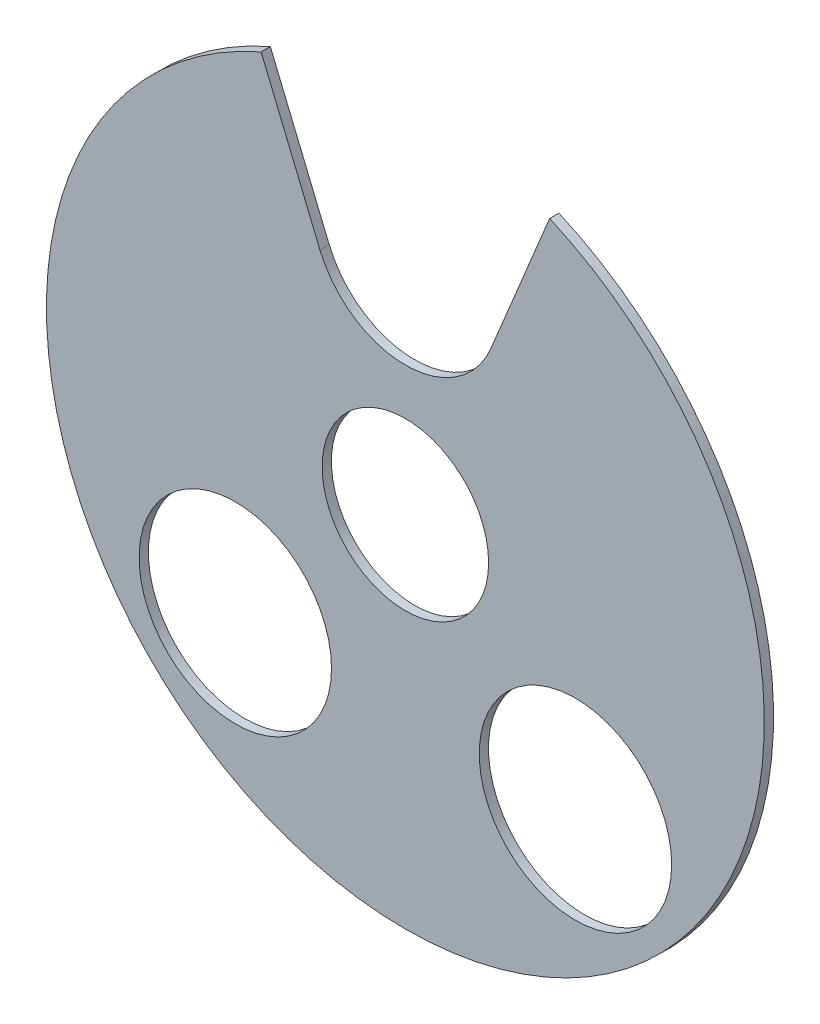
from build123d import *

# Parameters (mm, degrees)
ESQUISSE1_R      = 97
ESQUISSE1_R_2    = 22.5
MAIN_DEPTH       = 2.5
HOLES_DEPTH      = 138.201494161
HOLES_DEPTH_BACK = 138.201494161
ESQUISSE2_R      = 26


with BuildPart() as part:
    # Esquisse1 → Main (new body)
    with BuildSketch(Plane.XY):
        Circle(ESQUISSE1_R)
        Circle(ESQUISSE1_R_2, mode=Mode.SUBTRACT)
    extrude(amount=MAIN_DEPTH)

    # Esquisse2 → Holes (cut, two sides: drawn at the far end of the back side and taken through both)
    with BuildSketch(Plane.XY.offset(2.5).offset(-HOLES_DEPTH_BACK)):
        with Locations((-45.961940777, -45.961940777)):
            Circle(ESQUISSE2_R)
        with Locations((45.961940777, -45.961940777)):
            Circle(ESQUISSE2_R)
        with BuildLine():
            Line((-23.096988313, 50.432914191), (-38.995875853, 88.816224117))
            ThreePointArc((-38.995875853, 88.816224117), (0, 97), (38.995875853, 88.816224117))
            Line((38.995875853, 88.816224117), (23.096988313, 50.432914191))
            ThreePointArc((23.096988313, 50.432914191), (0, 35), (-23.096988313, 50.432914191))
        make_face()
    extrude(amount=HOLES_DEPTH + HOLES_DEPTH_BACK, mode=Mode.SUBTRACT)


solid = part.part
